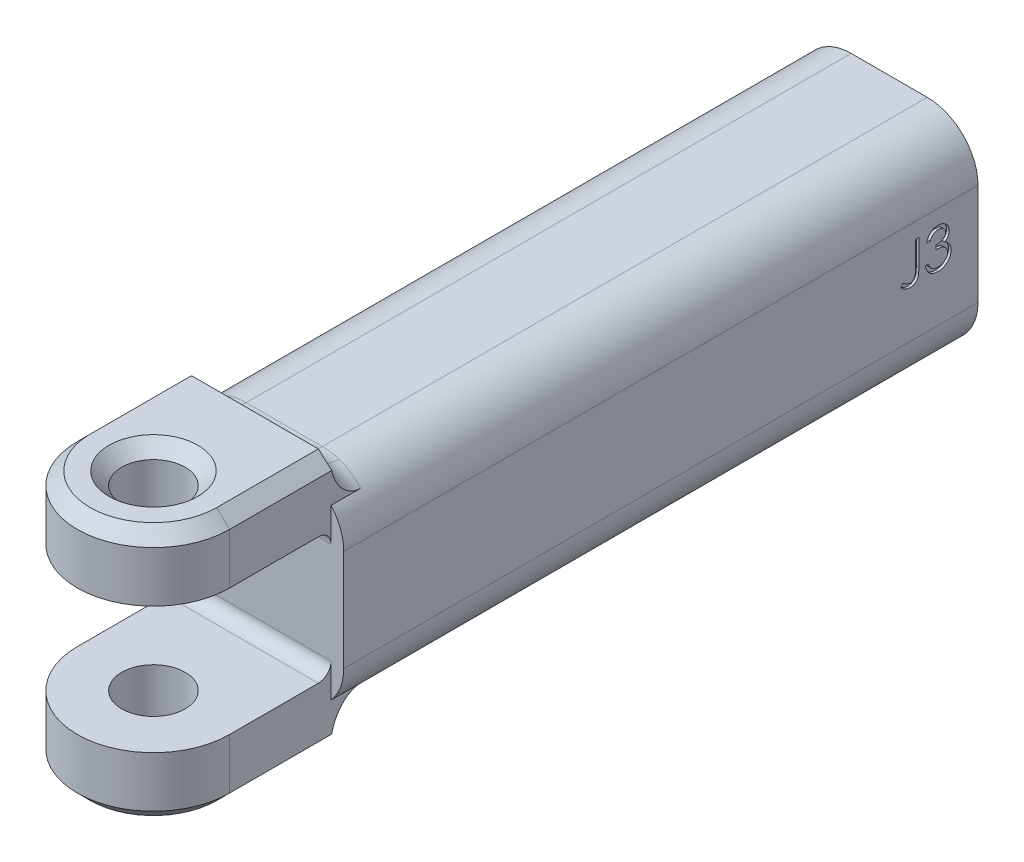
from build123d import *

# Parameters (mm, degrees)
SKETCH1_W             = 60
SKETCH1_H             = 25
BOSS_EXTRUDE1_DEPTH   = 80
BOSS_EXTRUDE1_2_DEPTH = 80
FILLET1_R             = 10
FILLET2_R             = 10
SKETCH2_W             = 70
SKETCH2_H             = 80
BOSS_EXTRUDE2_DEPTH   = 250
FILLET3_R             = 20
SKETCH3_R             = 12.5
CUT_EXTRUDE1_DEPTH    = 120
CUT_EXTRUDE2_DEPTH    = 120
FILLET6_R             = 11.684334192
FILLET7_R             = 5
CHAMFER2_SIZE         = 5
SKETCH5_W             = 60
SKETCH5_H             = 60
CUT_EXTRUDE3_DEPTH    = 150
FILLET8_R             = 10
CUT_EXTRUDE4_DEPTH    = 1
CHAMFER3_SIZE         = 5


with BuildPart() as part:
    # Sketch1 → Boss-Extrude1 (new body)
    with BuildSketch(Plane.XY):
        with Locations((12.227870146, -37.5)):
            Rectangle(SKETCH1_W, SKETCH1_H)
    extrude(amount=BOSS_EXTRUDE1_DEPTH)

    # Fillet2
    fillet2_edges = [part.edges().sort_by_distance(p)[0] for p in [
        (42.227870146, -37.5, 80),
        (-17.772129854, -37.5, 80),
    ]]
    fillet(fillet2_edges, radius=FILLET2_R)



with BuildPart() as body_2:
    # Sketch1 → Boss-Extrude1 2 (new body)
    with BuildSketch(Plane.XY):
        with Locations((12.227870146, 37.5)):
            Rectangle(SKETCH1_W, SKETCH1_H)
    extrude(amount=BOSS_EXTRUDE1_2_DEPTH)

    # Fillet1
    fillet1_edges = [body_2.edges().sort_by_distance(p)[0] for p in [
        (-17.772129854, 37.5, 80),
        (42.227870146, 37.5, 80),
    ]]
    fillet(fillet1_edges, radius=FILLET1_R)


with BuildPart() as part_1:
    add(part.part)

    add(body_2.part)  # Boss-Extrude2 merges body 2
    # Sketch2 → Boss-Extrude2 (add)
    with BuildSketch(Plane(origin=(0, 0, 0), x_dir=(-1, 0, 0), z_dir=(0, 0, -1))):
        with Locations((-12.227870146, 0)):
            Rectangle(SKETCH2_W, SKETCH2_H)
    extrude(amount=BOSS_EXTRUDE2_DEPTH)

    # Fillet3
    # the kernel refuses this fillet: 20 mm, written as the material it takes off along each edge
    with BuildSketch(Plane(origin=(-22.772129854, 40, 0), x_dir=(1, 0, 0), z_dir=(0, 0, -1)), Plane(origin=(47.227870146, -40, 0), x_dir=(-1, 0, 0), z_dir=(0, 0, -1)), Plane(origin=(-22.772129854, -40, 0), x_dir=(0, 1, 0), z_dir=(0, 0, -1))) as fillet3_piece_1:
        with BuildLine():
            CenterArc((FILLET3_R, FILLET3_R), FILLET3_R, 180, 90)
            Line((0, FILLET3_R), (0, 0))
            Line((0, 0), (FILLET3_R, 0))
        make_face()
    extrude(amount=300, mode=Mode.SUBTRACT)
    with BuildSketch(Plane(origin=(47.227870146, 40, 0), x_dir=(-1, 0, 0), z_dir=(0, 0, -1))) as fillet3_piece_2:
        with BuildLine():
            CenterArc((FILLET3_R, -FILLET3_R), FILLET3_R, 90, 90)
            Line((0, -FILLET3_R), (0, 0))
            Line((0, 0), (FILLET3_R, 0))
        make_face()
    extrude(amount=300, mode=Mode.SUBTRACT)

    # Sketch3 → Cut-Extrude1 (cut)
    with BuildSketch(Plane(origin=(0, 50, 0), x_dir=(1, 0, 0), z_dir=(0, 1, 0))):
        with Locations(Location((12.227870146, -40, 0), (0, 0, 270))):
            Circle(SKETCH3_R)
    extrude(amount=-CUT_EXTRUDE1_DEPTH, mode=Mode.SUBTRACT)

    # Sketch4 → Cut-Extrude2 (cut)
    with BuildSketch(Plane.XZ.offset(50)):
        with BuildLine():
            Line((-17.772129854, 40), (-17.772129854, 89.100205956))
            Line((-17.772129854, 89.100205956), (42.227870146, 89.100205956))
            Line((42.227870146, 89.100205956), (42.227870146, 40))
            ThreePointArc((42.227870146, 40), (12.227870146, 70), (-17.772129854, 40))
        make_face()
    extrude(amount=-CUT_EXTRUDE2_DEPTH, mode=Mode.SUBTRACT)

    # Fillet6
    fillet6_edges = [part_1.edges().sort_by_distance(p)[0] for p in [
        (12.227870146, -40, 0),
        (12.227870146, 40, 0),
        (-11.00088641, -38.228756555, 0),
        (35.456626701, -38.228756555, 0),
        (35.456626701, 38.228756555, 0),
        (-11.00088641, 38.228756555, 0),
    ]]
    fillet(fillet6_edges, radius=FILLET6_R)

    # Fillet7
    fillet7_edges = [part_1.edges().sort_by_distance(p)[0] for p in [
        (12.227870146, 25, 0),
        (12.227870146, -25, 0),
    ]]
    fillet(fillet7_edges, radius=FILLET7_R)

    # Chamfer2
    # the kernel refuses this chamfer: 5 mm, written as the material it takes off along each edge
    with BuildSketch(Plane(origin=(-17.772129854, 50, -12.85841494), x_dir=(-0.027495876610586317, -0.9996219169112968, 0), z_dir=(0, 0, 1)), Plane(origin=(42.227870146, -50, -12.85841494), x_dir=(0.027495876610586317, 0.9996219169112968, 0), z_dir=(0, 0, 1))) as chamfer2_piece_1:
        Polygon((CHAMFER2_SIZE * 0.999621916911, CHAMFER2_SIZE * 0.0274958766106), (-CHAMFER2_SIZE * 0.0274958766106, CHAMFER2_SIZE * 0.999621916911), (0, 0), align=None)
    extrude(amount=52.85841494, mode=Mode.SUBTRACT)
    with BuildSketch(Plane(origin=(12.227870146, 50, 40), x_dir=(1, 0, 0), z_dir=(0, 0, -1))) as chamfer2_piece_2:
        Polygon((30 - CHAMFER2_SIZE, 0), (30, CHAMFER2_SIZE), (30, 0), align=None)
    revolve(axis=Axis((12.227870146, 50, 40), (0, -1, 0)), revolution_arc=180, mode=Mode.SUBTRACT)
    with BuildSketch(Plane(origin=(42.227870146, 50, -12.85841494), x_dir=(0.027495876610586317, -0.9996219169112968, 0), z_dir=(0, 0, 1)), Plane(origin=(-17.772129854, -50, -12.85841494), x_dir=(-0.027495876610586317, 0.9996219169112968, 0), z_dir=(0, 0, 1))) as chamfer2_piece_3:
        Polygon((CHAMFER2_SIZE * 0.999621916911, -CHAMFER2_SIZE * 0.0274958766106), (-CHAMFER2_SIZE * 0.0274958766106, -CHAMFER2_SIZE * 0.999621916911), (0, 0), align=None)
    extrude(amount=52.85841494, mode=Mode.SUBTRACT)
    with BuildSketch(Plane(origin=(12.227870146, -50, 40), x_dir=(1, 0, 0), z_dir=(0, 0, -1))) as chamfer2_piece_4:
        Polygon((30, -CHAMFER2_SIZE), (30 - CHAMFER2_SIZE, 0), (30, 0), align=None)
    revolve(axis=Axis((12.227870146, -50, 40), (0, -1, 0)), revolution_arc=180, mode=Mode.SUBTRACT)

    # Sketch5 → Cut-Extrude3 (cut)
    with BuildSketch(Plane(origin=(0, 0, -250), x_dir=(-1, 0, 0), z_dir=(0, 0, -1))):
        with Locations((-12.037629924, 0)):
            Rectangle(SKETCH5_W, SKETCH5_H)
    extrude(amount=-CUT_EXTRUDE3_DEPTH, mode=Mode.SUBTRACT)

    # Fillet8
    fillet8_edges = [part_1.edges().sort_by_distance(p)[0] for p in [
        (-17.962370076, 30, -175),
        (-17.962370076, -30, -175),
        (42.037629924, -30, -175),
        (42.037629924, 30, -175),
    ]]
    fillet(fillet8_edges, radius=FILLET8_R)

    # Sketch6 → Cut-Extrude4 (cut)
    with BuildSketch(Plane(origin=(47.227870146, 0, 0), x_dir=(0, 0, -1), z_dir=(1, 0, 0))):
        with BuildLine():
            Line((225.355573702, 13.793064837), (226.701727548, 13.793064837))
            Line((226.701727548, 13.793064837), (226.701727548, 3.663858107))
            add(Edge.make_bspline(
                [(226.701727548, 3.663858107), (226.700382182, 3.476550231), (226.697798916, 3.116896255), (226.6835943, 2.598865272), (226.657307966, 2.125848046), (226.619015055, 1.696768987), (226.567928343, 1.312972322), (226.509466794, 0.971492531), (226.438697656, 0.675179607), (226.332127086, 0.342456654), (226.157381592, -0.022445367), (225.89438, -0.416538869), (225.567668016, -0.761253486), (225.189235016, -1.060622307), (224.755773485, -1.299153298), (224.276209688, -1.470389777), (223.753495742, -1.574836305), (223.390927689, -1.585867327), (223.204131394, -1.591550547)],
                knots=[0, 0, 0, 0, 1.237770943, 2.376671248, 3.424123796, 4.367912054, 5.222547132, 5.982086412, 6.656319012, 7.234008312, 8.288027371, 9.317870876, 10.352700517, 11.413286737, 12.494591526, 13.606319346, 14.766767577, 16, 16, 16, 16], degree=3))
            add(Edge.make_bspline(
                [(223.204131394, -1.591550547), (223.058595573, -1.586919365), (222.765767861, -1.57760112), (222.329950538, -1.501650922), (221.895370642, -1.384582164), (221.459721575, -1.21314247), (221.014396255, -0.979975619), (220.553363341, -0.674897834), (220.070692522, -0.298477006), (219.752764153, -0.011172382), (219.586342932, 0.139218684)],
                knots=[0, 0, 0, 0, 0.848567217, 1.707373443, 2.573483905, 3.470863513, 4.432650262, 5.500696352, 6.691726801, 8, 8, 8, 8], degree=3))
            Line((219.586342932, 0.139218684), (220.379612163, 1.293064837))
            add(Edge.make_bspline(
                [(220.379612163, 1.293064837), (220.562623645, 1.166861711), (220.908173185, 0.928573752), (221.41604936, 0.622031179), (221.866037159, 0.359209041), (222.160392647, 0.225270702), (222.296679471, 0.163257145)],
                knots=[0, 0, 0, 0, 1.196737151, 2.259595785, 3.194191475, 4, 4, 4, 4], degree=3))
            add(Edge.make_bspline(
                [(222.296679471, 0.163257145), (222.37932652, 0.130859471), (222.541415788, 0.067320417), (222.789237558, -0.003590576), (223.03564486, -0.042343761), (223.199006405, -0.049549475), (223.279251586, -0.053089009)],
                knots=[0, 0, 0, 0, 1.051806502, 2.062826769, 3.048436908, 4, 4, 4, 4], degree=3))
            add(Edge.make_bspline(
                [(223.279251586, -0.053089009), (223.382892108, -0.048705859), (223.587751206, -0.040041988), (223.885454038, 0.036454906), (224.170274172, 0.153216633), (224.432001276, 0.324179321), (224.673224363, 0.527456838), (224.872265044, 0.773268304), (225.038196092, 1.045693949), (225.138051921, 1.303571609), (225.201672372, 1.538757167), (225.242050773, 1.754899178), (225.277359318, 2.007591229), (225.308137397, 2.297134944), (225.326156557, 2.624110011), (225.34637344, 2.987556337), (225.353681701, 3.388390247), (225.354923791, 3.667865755), (225.355573702, 3.814098491)],
                knots=[0, 0, 0, 0, 0.997221856, 1.971139923, 2.944579524, 3.951425367, 4.971190333, 5.972282193, 6.985401279, 8.033996657, 8.624075553, 9.332086008, 10.151144245, 11.082816738, 12.137127781, 13.306538797, 14.590673636, 16, 16, 16, 16], degree=3))
            Line((225.355573702, 3.814098491), (225.355573702, 13.793064837))
        make_face()
        with BuildLine():
            Line((231.124804471, 10.331526376), (229.778650625, 10.331526376))
            add(Edge.make_bspline(
                [(229.778650625, 10.331526376), (229.815120128, 10.482522736), (229.886415023, 10.777708269), (230.035118909, 11.199453672), (230.197115717, 11.598554478), (230.391640451, 11.967537651), (230.603820826, 12.313818663), (230.846918204, 12.629543482), (231.109717015, 12.922741906), (231.400395369, 13.182941495), (231.705232491, 13.418560335), (232.028523718, 13.619453438), (232.363764691, 13.792271236), (232.713278118, 13.934643658), (233.078104568, 14.041895902), (233.454945811, 14.119710783), (233.844789383, 14.17024413), (234.109421914, 14.175175972), (234.243794855, 14.177680222)],
                knots=[0, 0, 0, 0, 1.162005537, 2.271625781, 3.343758855, 4.383309926, 5.390229558, 6.379919256, 7.361854164, 8.333198761, 9.295911338, 10.242430842, 11.177959212, 12.116337295, 13.062827104, 14.020064771, 14.994644689, 16, 16, 16, 16], degree=3))
            add(Edge.make_bspline(
                [(234.243794855, 14.177680222), (234.439578036, 14.171769235), (234.826873797, 14.160076198), (235.395858284, 14.053300041), (235.944544651, 13.884335188), (236.466927142, 13.650876358), (236.952148996, 13.36293073), (237.383875511, 13.020224715), (237.756254843, 12.629370565), (238.068659318, 12.197659575), (238.313266457, 11.736278821), (238.493636629, 11.261421005), (238.603443834, 10.774212556), (238.617674791, 10.445252788), (238.624804471, 10.280444645)],
                knots=[0, 0, 0, 0, 1.083050992, 2.142477498, 3.193116406, 4.255571735, 5.30263384, 6.308962982, 7.297363603, 8.282367274, 9.249857812, 10.179914175, 11.08814088, 12, 12, 12, 12], degree=3))
            add(Edge.make_bspline(
                [(238.624804471, 10.280444645), (238.619817652, 10.121844096), (238.610059222, 9.811487434), (238.527200483, 9.358395304), (238.387759357, 8.931359874), (238.194603231, 8.528583465), (237.944568016, 8.152619866), (237.641685029, 7.802623191), (237.283816479, 7.477041084), (237.01262103, 7.290529057), (236.873001586, 7.194507145)],
                knots=[0, 0, 0, 0, 1.024540389, 2.004866551, 2.965041327, 3.920577974, 4.882998113, 5.874504559, 6.905732034, 8, 8, 8, 8], degree=3))
            add(Edge.make_bspline(
                [(236.873001586, 7.194507145), (237.032566249, 7.117457838), (237.348709995, 6.964800877), (237.779640836, 6.665419059), (238.170831731, 6.319748999), (238.388990526, 6.049994773), (238.498602548, 5.914459068)],
                knots=[0, 0, 0, 0, 1.015518401, 2.012035669, 3.001164323, 4, 4, 4, 4], degree=3))
            add(Edge.make_bspline(
                [(238.498602548, 5.914459068), (238.570779729, 5.815640133), (238.713952141, 5.61962049), (238.890675857, 5.304464379), (239.051000633, 4.98581514), (239.175930144, 4.655131971), (239.272675288, 4.316247626), (239.341829711, 3.968580215), (239.384790315, 3.611845833), (239.390942681, 3.370506632), (239.39403524, 3.249194645)],
                knots=[0, 0, 0, 0, 1.025084078, 2.033381695, 3.024893161, 4.013698104, 4.991890475, 5.976764909, 6.982997093, 8, 8, 8, 8], degree=3))
            add(Edge.make_bspline(
                [(239.39403524, 3.249194645), (239.386344468, 3.039152983), (239.370999116, 2.620058118), (239.233838798, 2.000880739), (239.021210623, 1.395628587), (238.719252326, 0.816736419), (238.351248717, 0.275106214), (237.913431613, -0.209506539), (237.410775577, -0.626071986), (236.85017994, -0.97411582), (236.242820817, -1.252335487), (235.593211137, -1.445438813), (234.910710906, -1.571207383), (234.442679631, -1.584693964), (234.204732355, -1.591550547)],
                knots=[0, 0, 0, 0, 0.955779014, 1.907060117, 2.875433937, 3.871313158, 4.872415639, 5.851225146, 6.836215519, 7.83643374, 8.849228613, 9.86973379, 10.916971861, 12, 12, 12, 12], degree=3))
            add(Edge.make_bspline(
                [(234.204732355, -1.591550547), (234.044363926, -1.587829633), (233.728812332, -1.580508115), (233.264911625, -1.530456967), (232.822104342, -1.439042659), (232.39979178, -1.316028493), (231.997598767, -1.160063884), (231.616752602, -0.965840893), (231.254910201, -0.737363027), (230.915486125, -0.471933365), (230.598520834, -0.175013337), (230.312437731, 0.158668134), (230.052467189, 0.522942722), (229.825570166, 0.922041534), (229.621411798, 1.350806923), (229.453493412, 1.814729059), (229.305698118, 2.309660581), (229.236983271, 2.654565182), (229.201727548, 2.831526376)],
                knots=[0, 0, 0, 0, 1.048658725, 2.063410685, 3.046034179, 4.001477787, 4.936774919, 5.862367409, 6.792675028, 7.730719943, 8.675894397, 9.627829632, 10.600096036, 11.597688215, 12.626045268, 13.701542398, 14.82072376, 16, 16, 16, 16], degree=3))
            Line((229.201727548, 2.831526376), (230.547881394, 2.831526376))
            add(Edge.make_bspline(
                [(230.547881394, 2.831526376), (230.582952643, 2.716030605), (230.651169269, 2.491381298), (230.767287689, 2.168065702), (230.899580283, 1.871674045), (231.04149982, 1.600032094), (231.190550303, 1.350464655), (231.357328554, 1.12957093), (231.529482033, 0.927648635), (231.65925069, 0.813886013), (231.722761202, 0.758209068)],
                knots=[0, 0, 0, 0, 1.198163088, 2.33053128, 3.407730985, 4.417276592, 5.372219308, 6.28897303, 7.162600585, 8, 8, 8, 8], degree=3))
            add(Edge.make_bspline(
                [(231.722761202, 0.758209068), (231.80674653, 0.693459066), (231.974457942, 0.56415893), (232.247750361, 0.39915195), (232.535171301, 0.256176127), (232.842948476, 0.146960288), (233.16444035, 0.054484599), (233.504843344, -0.006031911), (233.861154274, -0.047552645), (234.104444689, -0.051216638), (234.228770817, -0.053089009)],
                knots=[0, 0, 0, 0, 0.946170439, 1.889420265, 2.845303464, 3.807233317, 4.801018734, 5.828864929, 6.890507805, 8, 8, 8, 8], degree=3))
            add(Edge.make_bspline(
                [(234.228770817, -0.053089009), (234.369142971, -0.050449415), (234.643628601, -0.045287917), (235.044149426, 0.002179398), (235.425181345, 0.071309742), (235.782493884, 0.178079668), (236.120767487, 0.309997603), (236.435260271, 0.475633626), (236.730100726, 0.669968147), (237.001512463, 0.890850256), (237.245564638, 1.132656663), (237.460448267, 1.385569825), (237.643125387, 1.64852338), (237.790483579, 1.92297247), (237.906843081, 2.207780594), (237.986056797, 2.503747005), (238.041134719, 2.808449575), (238.0456202, 3.015573727), (238.047881394, 3.119987914)],
                knots=[0, 0, 0, 0, 1.217147791, 2.380027433, 3.494444702, 4.572153297, 5.609568379, 6.639424714, 7.649109417, 8.668170816, 9.669597737, 10.625200337, 11.543417969, 12.441394052, 13.322311151, 14.205496177, 15.095365482, 16, 16, 16, 16], degree=3))
            add(Edge.make_bspline(
                [(238.047881394, 3.119987914), (238.041322959, 3.259750795), (238.028238722, 3.538581116), (237.92834481, 3.948799292), (237.764035392, 4.344042488), (237.534010344, 4.717567302), (237.254000078, 5.063749738), (236.926721906, 5.37262752), (236.54945807, 5.627499339), (236.20223006, 5.80359358), (235.894665104, 5.923752474), (235.631456313, 6.003788036), (235.336785156, 6.071560846), (235.014215089, 6.134613438), (234.66131559, 6.188276359), (234.278470856, 6.233026998), (233.865603306, 6.268834316), (233.579784024, 6.284824724), (233.432496778, 6.293064837)],
                knots=[0, 0, 0, 0, 1.07054697, 2.135767047, 3.216561865, 4.33974944, 5.486079747, 6.621378074, 7.775625952, 8.963672916, 9.598146892, 10.304877434, 11.070270905, 11.915000392, 12.823868403, 13.805723172, 14.86925407, 16, 16, 16, 16], degree=3))
            Line((233.432496778, 6.293064837), (233.432496778, 7.831526376))
            add(Edge.make_bspline(
                [(233.432496778, 7.831526376), (233.618073203, 7.834675535), (233.981571831, 7.840843963), (234.512547423, 7.915449722), (235.020290189, 8.018652414), (235.493547655, 8.176731809), (235.924899284, 8.360333081), (236.29912615, 8.573985408), (236.610985352, 8.81147719), (236.858961373, 9.076474088), (237.04551521, 9.360681434), (237.18191577, 9.656895681), (237.262488597, 9.967713085), (237.273244313, 10.179833091), (237.278650625, 10.28645426)],
                knots=[0, 0, 0, 0, 1.321986639, 2.589447074, 3.816329219, 5.01088745, 6.139805852, 7.153945165, 8.075214402, 8.924034688, 9.728124013, 10.488707548, 11.240355623, 12, 12, 12, 12], degree=3))
            add(Edge.make_bspline(
                [(237.278650625, 10.28645426), (237.276874578, 10.364787454), (237.273341216, 10.520627627), (237.228781454, 10.748306493), (237.161821279, 10.969024833), (237.069765296, 11.18184402), (236.946550159, 11.385288051), (236.799095931, 11.581091403), (236.623518358, 11.76813617), (236.422323585, 11.942480397), (236.206272993, 12.108634271), (235.969488242, 12.249692715), (235.719108779, 12.370314409), (235.454857401, 12.469783704), (235.175876557, 12.544609225), (234.883477024, 12.59833426), (234.577101238, 12.631924208), (234.368079529, 12.636760277), (234.261823702, 12.639218684)],
                knots=[0, 0, 0, 0, 0.884392785, 1.759457502, 2.611959086, 3.489218968, 4.37281399, 5.2945488, 6.255912374, 7.266815255, 8.301784654, 9.332968512, 10.37626691, 11.440494194, 12.520033166, 13.637162961, 14.798855837, 16, 16, 16, 16], degree=3))
            add(Edge.make_bspline(
                [(234.261823702, 12.639218684), (234.091030839, 12.633255704), (233.757432654, 12.621608617), (233.276511582, 12.519595702), (232.829428722, 12.356832487), (232.487691579, 12.162548118), (232.23533769, 11.970760544), (232.055007955, 11.803264603), (231.877920053, 11.61712393), (231.715724295, 11.40087375), (231.551692967, 11.169158935), (231.402359131, 10.9102003), (231.257246165, 10.630752896), (231.169806666, 10.433200176), (231.124804471, 10.331526376)],
                knots=[0, 0, 0, 0, 1.472543308, 2.876219568, 4.221790263, 5.565193594, 6.249813518, 6.953379497, 7.687249741, 8.463570142, 9.283606569, 10.136032583, 11.040678096, 12, 12, 12, 12], degree=3))
        make_face()
    extrude(amount=-CUT_EXTRUDE4_DEPTH, mode=Mode.SUBTRACT)

    # Chamfer3
    chamfer3_edges = [part_1.edges().sort_by_distance(p)[0] for p in [
        (12.227870146, -50, 27.5),
        (12.227870146, 50, 27.5),
    ]]
    chamfer(chamfer3_edges, length=CHAMFER3_SIZE)


solid = part_1.part
